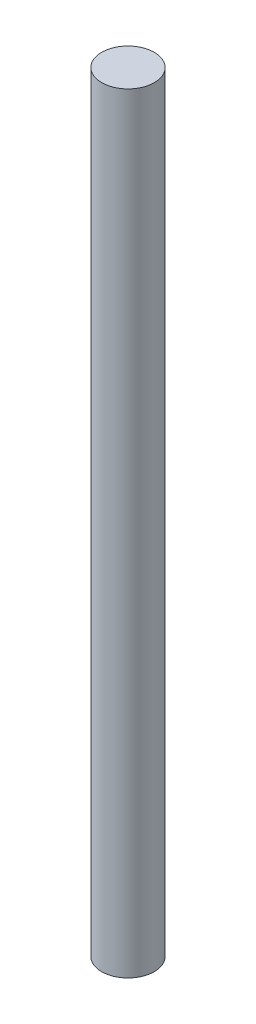
from build123d import *

# Parameters (mm, degrees)
SKETCH1_R           = 1.25
BOSS_EXTRUDE1_DEPTH = 36.6


with BuildPart() as part:
    # Sketch1 → Boss-Extrude1 (new body)
    with BuildSketch(Plane(origin=(0, 0, 0), x_dir=(1, 0, 0), z_dir=(0, 1, 0))):
        Circle(SKETCH1_R)
    extrude(amount=BOSS_EXTRUDE1_DEPTH)


solid = part.part
